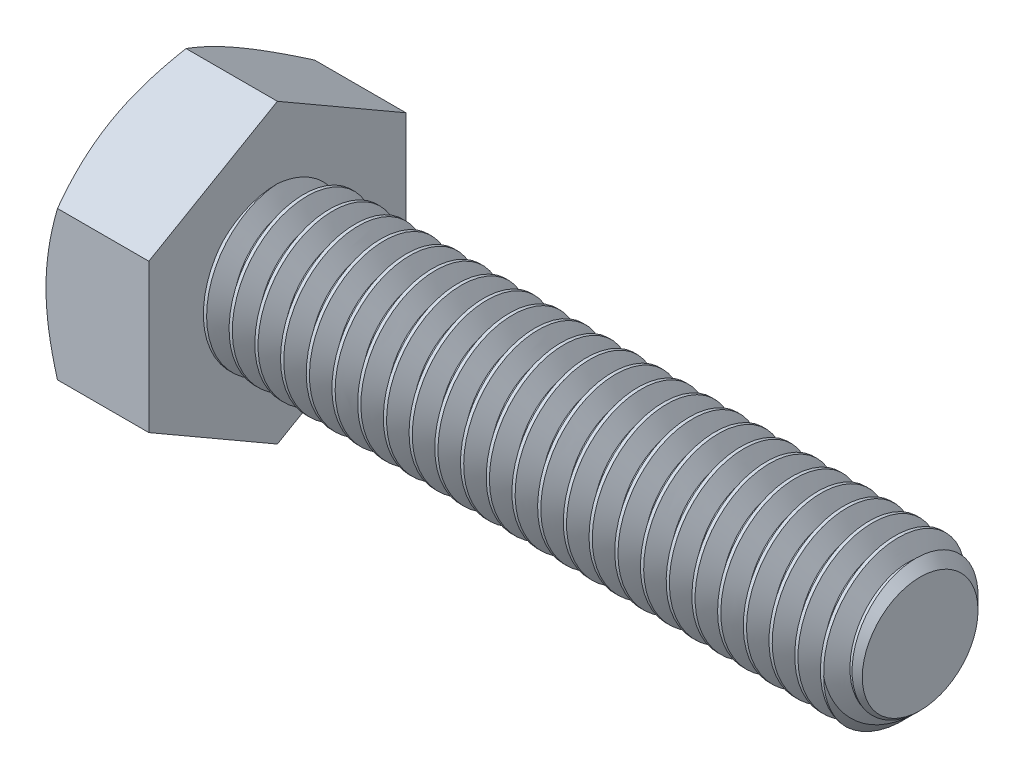
from build123d import *

# Parameters (mm, degrees)
SKETCH2_R           = 3
BOSS_EXTRUDE1_DEPTH = 25
CHAMFER1_SIZE       = 0.75
CUT_SWEEP1_PITCH    = 1
BOSS_EXTRUDE2_DEPTH = 4
SKETCH6_OUTSIDE_W   = 125.904
SKETCH6_OUTSIDE_H   = 127.452
SKETCH6_OUTSIDE_R   = 5
CUT_EXTRUDE1_DEPTH  = 30.988886963
CUT_EXTRUDE1_DRAFT  = -60


with BuildPart() as part:
    # Sketch2 → Boss-Extrude1 (new body)
    with BuildSketch(Plane(origin=(14.5, 0, 0), x_dir=(0, 0, -1), z_dir=(1, 0, 0))):
        Circle(SKETCH2_R)
    extrude(amount=-BOSS_EXTRUDE1_DEPTH)

    # Chamfer1
    chamfer1_edges = [part.edges().sort_by_distance(p)[0] for p in [
        (14.5, 0, 3),
    ]]
    chamfer(chamfer1_edges, length=CHAMFER1_SIZE)

    # Cut-Sweep1: the profile of Sketch5 profile screwed along a right-hand helix of 26 turns, 8 arcs to a turn; built about Z, then put on its axis
    cut_sweep1_z = Axis((0, 0, 0), (0, 0, 1))
    cut_sweep1_corners = [(3.0003, 0, 0.000173205), (2.350480947, 0, -0.375), (2.350480947, 0, -0.5), (3.0003, 0, -0.875173205)]
    with BuildLine(mode=Mode.PRIVATE) as cut_sweep1_profile:
        Line(cut_sweep1_corners[0], cut_sweep1_corners[1])
        Line(cut_sweep1_corners[1], cut_sweep1_corners[2])
        Line(cut_sweep1_corners[2], cut_sweep1_corners[3])
        Line(cut_sweep1_corners[3], cut_sweep1_corners[0])
    cut_sweep1_cap = Face(cut_sweep1_profile.wire())
    cut_sweep1_turn_angles = [0, 22.5, 45, 67.5, 90, 112.5, 135, 157.5, 180, 202.5, 225, 247.5, 270, 292.5, 315, 337.5, 360]
    cut_sweep1_turn_weights = [1, 0.9238795325112867, 1, 0.9238795325112867, 1, 0.9238795325112867, 1, 0.9238795325112867, 1, 0.9238795325112867, 1, 0.9238795325112867, 1, 0.9238795325112867, 1, 0.9238795325112867, 1]
    cut_sweep1_turn_rails = [Edge.make_bspline([Vector(p[0], p[1], 0).rotate(cut_sweep1_z, cut_sweep1_turn_angles[k]) / cut_sweep1_turn_weights[k] + Vector(0, 0, p[2] + CUT_SWEEP1_PITCH * cut_sweep1_turn_angles[k] / 360) for k in range(17)], [0, 0, 0, 1, 1, 2, 2, 3, 3, 4, 4, 5, 5, 6, 6, 7, 7, 8, 8, 8], 2, cut_sweep1_turn_weights) for p in cut_sweep1_corners]
    cut_sweep1_turn_sides = [Face.make_surface_from_curves(cut_sweep1_turn_rails[p[0]], cut_sweep1_turn_rails[p[1]]) for p in [(0, 1), (1, 2), (2, 3), (3, 0)]]
    cut_sweep1 = Plane(origin=(14.5, 0, 0), x_dir=(0, 1, 0), z_dir=(-1, 0, 0)) * Solid(Shell([*[p.moved(Location((0, 0, CUT_SWEEP1_PITCH * i))) for i in range(26) for p in cut_sweep1_turn_sides], cut_sweep1_cap, cut_sweep1_cap.rotate(cut_sweep1_z, 9360).moved(Location((0, 0, CUT_SWEEP1_PITCH * 9360 / 360)))]))
    add(cut_sweep1, mode=Mode.SUBTRACT)

    # Sketch3 → Boss-Extrude2 (add)
    with BuildSketch(Plane.ZY.offset(10.5)):
        Polygon((-5, -2.886751346), (0, -5.773502692), (5, -2.886751346), (5, 2.886751346), (0, 5.773502692), (-5, 2.886751346), align=None)
    extrude(amount=BOSS_EXTRUDE2_DEPTH)


with BuildPart() as cut_extrude1_tool:
    # Sketch6 outside → Cut-Extrude1 (with draft: the straight prism first)
    with BuildSketch(Plane.ZY.offset(14.5)):
        Rectangle(SKETCH6_OUTSIDE_W, SKETCH6_OUTSIDE_H)
        Circle(SKETCH6_OUTSIDE_R, mode=Mode.SUBTRACT)
    extrude(amount=-CUT_EXTRUDE1_DEPTH)
    # Cut-Extrude1: the draft: its side faces are tilted about the plane it starts from
    cut_extrude1_sides = [cut_extrude1_tool.faces().sort_by_distance(p)[0] for p in [
        (0.994443482, -63.726, 0),
        (0.994443482, 0, 62.952),
        (0.994443482, 63.726, 0),
        (0.994443482, 0, -62.952),
        (0.994443482, 0, -5),
    ]]
    draft(cut_extrude1_sides, Plane.ZY.offset(14.5), CUT_EXTRUDE1_DRAFT)


with BuildPart() as part_1:
    add(part.part)

    # Cut-Extrude1: cut by cut_extrude1_tool
    add(cut_extrude1_tool.part, mode=Mode.SUBTRACT)


solid = part_1.part
